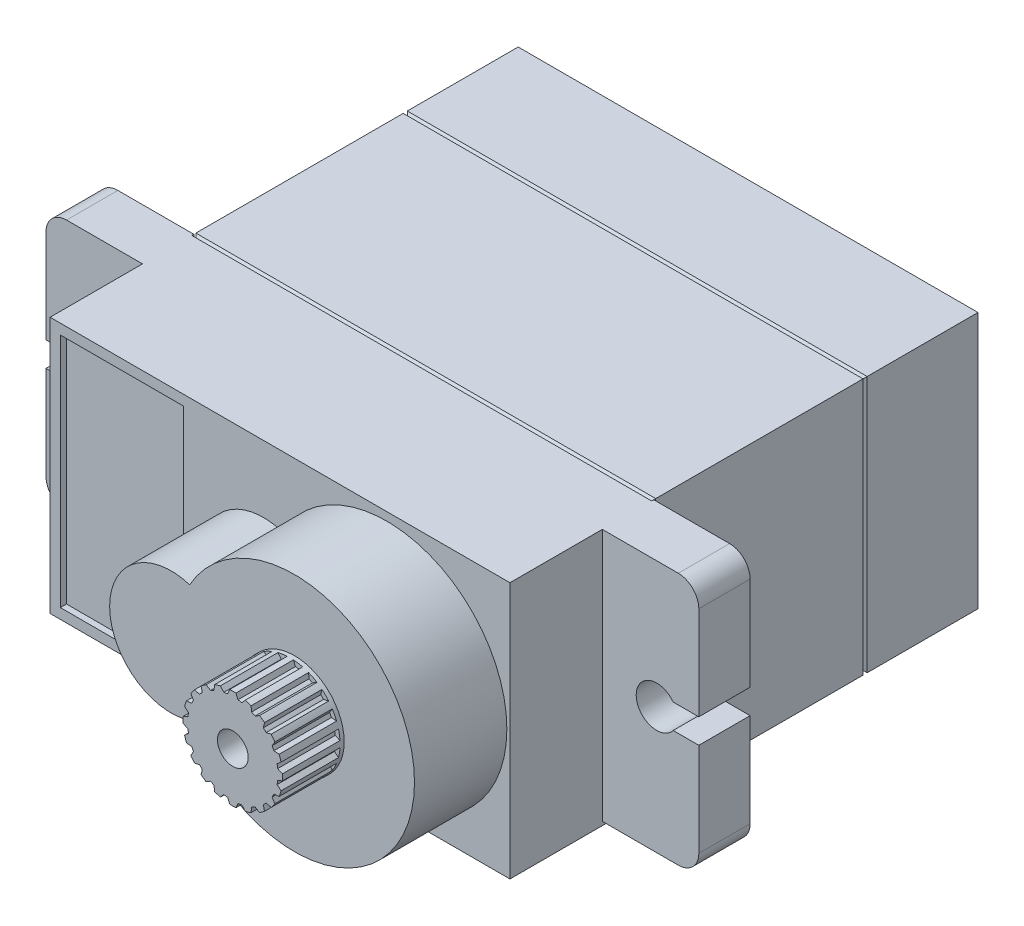
from build123d import *

# Parameters (mm, degrees)
SKETCH_1_W          = 22.4
SKETCH_1_H          = 12.5
EXTRUDE_1_DEPTH     = 5.5
CHAMFER_1_SIZE      = 0.1
SKETCH_2_W          = 22.4
SKETCH_2_H          = 12.5
EXTRUDE_2_DEPTH     = 10.3
CHAMFER_2_SIZE      = 0.1
CHAMFER_3_SIZE      = 0.1
SKETCH_3_W          = 22.4
SKETCH_3_H          = 12.5
EXTRUDE_3_DEPTH     = 7
CHAMFER_4_SIZE      = 0.1
EXTRUDE_4_DEPTH     = 2.5
EXTRUDE_5_DEPTH     = 4.5
SKETCH_6_R          = 2.425
EXTRUDE_6_DEPTH     = 3
SKETCH_7_R          = 0.75
CUT_EXTRUDE_1_DEPTH = 6
CUT_EXTRUDE_START   = -2.8
CUT_EXTRUDE_2_DEPTH = 2.8
FILLET_2_R          = 1
SKETCH_12_W         = 6
SKETCH_12_H         = 11.5
CUT_EXTRUDE_3_DEPTH = 0.3
SKETCH_13_R         = 1
EXTRUDE_10_DEPTH    = 0.1


with BuildPart() as part:
    # 草图1 → 凸台-拉伸1 (new body)
    with BuildSketch(Plane.XY):
        Rectangle(SKETCH_1_W, SKETCH_1_H)
    extrude(amount=EXTRUDE_1_DEPTH)

    # 倒角1
    chamfer_1_edges = [part.edges().sort_by_distance(p)[0] for p in [
        (11.2, 0, 5.5),
        (0, 6.25, 5.5),
        (-11.2, 0, 5.5),
        (0, -6.25, 5.5),
    ]]
    chamfer(chamfer_1_edges, length=CHAMFER_1_SIZE)

    # 草图2 → 凸台-拉伸2 (add)
    with BuildSketch(Plane.XY.offset(5.5)):
        Rectangle(SKETCH_2_W, SKETCH_2_H)
    extrude(amount=EXTRUDE_2_DEPTH)

    # 倒角2
    chamfer_2_edges = [part.edges().sort_by_distance(p)[0] for p in [
        (0, 6.25, 5.5),
        (-11.2, 0, 5.5),
        (0, -6.25, 5.5),
        (11.2, 0, 5.5),
    ]]
    chamfer(chamfer_2_edges, length=CHAMFER_2_SIZE - 0.0001)  # a hair under: the kernel refuses the full size

    # 倒角3
    chamfer_3_edges = [part.edges().sort_by_distance(p)[0] for p in [
        (0, 6.25, 15.8),
        (-11.2, 0, 15.8),
        (0, -6.25, 15.8),
        (11.2, 0, 15.8),
    ]]
    chamfer(chamfer_3_edges, length=CHAMFER_3_SIZE)

    # 草图3 → 凸台-拉伸3 (add)
    with BuildSketch(Plane.XY.offset(15.8)):
        Rectangle(SKETCH_3_W, SKETCH_3_H)
    extrude(amount=EXTRUDE_3_DEPTH)

    # 倒角4
    chamfer_4_edges = [part.edges().sort_by_distance(p)[0] for p in [
        (0, 6.25, 15.8),
        (-11.2, 0, 15.8),
        (0, -6.25, 15.8),
        (11.2, 0, 15.8),
    ]]
    chamfer(chamfer_4_edges, length=CHAMFER_4_SIZE - 0.0001)  # a hair under: the kernel refuses the full size

    # 草图4 → 凸台-拉伸4 (add)
    with BuildSketch(Plane.XY.offset(15.8)):
        with BuildLine():
            Line((-15.9, -0.508346778), (-15.9, -6.066693556))
            Line((-15.9, -6.066693556), (-11.2, -6.066693556))
            Line((-11.2, -6.066693556), (-11.2, 6.25))
            Line((-11.2, 6.25), (-15.9, 6.25))
            Line((-15.9, 6.25), (-15.9, 0.691653222))
            Line((-15.9, 0.691653222), (-14.65, 0.691653222))
            ThreePointArc((-14.65, 0.691653222), (-12.85, 0.091653222), (-14.65, -0.508346778))
            Line((-14.65, -0.508346778), (-15.9, -0.508346778))
        make_face()
        with BuildLine():
            Line((11.2, -6.066693556), (15.9, -6.066693556))
            Line((15.9, -6.066693556), (15.9, -0.508346778))
            Line((15.9, -0.508346778), (14.65, -0.508346778))
            ThreePointArc((14.65, -0.508346778), (12.85, 0.091653222), (14.65, 0.691653222))
            Line((14.65, 0.691653222), (15.9, 0.691653222))
            Line((15.9, 0.691653222), (15.9, 6.25))
            Line((15.9, 6.25), (11.2, 6.25))
            Line((11.2, 6.25), (11.2, -6.066693556))
        make_face()
    extrude(amount=EXTRUDE_4_DEPTH)

    # 草图5 → 凸台-拉伸5 (add)
    with BuildSketch(Plane.XY.offset(22.8)):
        with BuildLine():
            ThreePointArc((0.098125, -2.86240659), (11.05, 0), (0.098125, 2.86240659))
            ThreePointArc((0.098125, 2.86240659), (-3.8, 0), (0.098125, -2.86240659))
        make_face()
    extrude(amount=EXTRUDE_5_DEPTH)

    # 草图6 → 凸台-拉伸6 (add)
    with BuildSketch(Plane.XY.offset(27.3)):
        with Locations((5.2, 0)):
            Circle(SKETCH_6_R)
    extrude(amount=EXTRUDE_6_DEPTH)

    # 草图7 → 切除-拉伸1 (cut)
    with BuildSketch(Plane.XY.offset(30.3)):
        with Locations((5.2, 0)):
            Circle(SKETCH_7_R)
    extrude(amount=-CUT_EXTRUDE_1_DEPTH, mode=Mode.SUBTRACT)

    # 草图8 → 切除-拉伸2 (cut)
    with BuildSketch(Plane.XY.offset(30.3).offset(CUT_EXTRUDE_START)):
        with BuildLine():
            Line((4.95, 2.185749299), (5.05, 2.420356379))
            ThreePointArc((5.05, 2.420356379), (4.820646422, 2.395144226), (4.594727224, 2.348248255))
            Line((4.594727224, 2.348248255), (4.76233045, 2.156025363))
            ThreePointArc((4.76233045, 2.156025363), (4.855844177, 2.172914349), (4.95, 2.185749299))
        make_face()
        with BuildLine():
            Line((5.45, 2.185749299), (5.35, 2.420356379))
            ThreePointArc((5.35, 2.420356379), (5.579353578, 2.395144226), (5.805272776, 2.348248255))
            Line((5.805272776, 2.348248255), (5.63766955, 2.156025363))
            ThreePointArc((5.63766955, 2.156025363), (5.544155823, 2.172914349), (5.45, 2.185749299))
        make_face()
        with BuildLine():
            Line((6.113197808, 2.001516866), (6.090589731, 2.255543157))
            ThreePointArc((6.090589731, 2.255543157), (6.300926962, 2.160690821), (6.501297236, 2.046277231))
            Line((6.501297236, 2.046277231), (6.282496955, 1.915254642))
            ThreePointArc((6.282496955, 1.915254642), (6.198779099, 1.960214353), (6.113197808, 2.001516866))
        make_face()
        with BuildLine():
            Line((6.687005452, 1.621362016), (6.744002334, 1.869941655))
            ThreePointArc((6.744002334, 1.869941655), (6.914733944, 1.714733944), (7.069941655, 1.544002334))
            Line((7.069941655, 1.544002334), (6.821362016, 1.487005452))
            ThreePointArc((6.821362016, 1.487005452), (6.755634919, 1.555634919), (6.687005452, 1.621362016))
        make_face()
        with BuildLine():
            Line((7.115254642, 1.082496955), (7.246277231, 1.301297236))
            ThreePointArc((7.246277231, 1.301297236), (7.360690821, 1.100926962), (7.455543157, 0.890589731))
            Line((7.455543157, 0.890589731), (7.201516866, 0.913197808))
            ThreePointArc((7.201516866, 0.913197808), (7.160214353, 0.998779099), (7.115254642, 1.082496955))
        make_face()
        with BuildLine():
            Line((7.356025363, 0.43766955), (7.548248255, 0.605272776))
            ThreePointArc((7.548248255, 0.605272776), (7.595144226, 0.379353578), (7.620356379, 0.15))
            Line((7.620356379, 0.15), (7.385749299, 0.25))
            ThreePointArc((7.385749299, 0.25), (7.372914349, 0.344155823), (7.356025363, 0.43766955))
        make_face()
        with BuildLine():
            Line((7.385749299, -0.25), (7.620356379, -0.15))
            ThreePointArc((7.620356379, -0.15), (7.595144226, -0.379353578), (7.548248255, -0.605272776))
            Line((7.548248255, -0.605272776), (7.356025363, -0.43766955))
            ThreePointArc((7.356025363, -0.43766955), (7.372914349, -0.344155823), (7.385749299, -0.25))
        make_face()
        with BuildLine():
            Line((7.201516866, -0.913197808), (7.455543157, -0.890589731))
            ThreePointArc((7.455543157, -0.890589731), (7.360690821, -1.100926962), (7.246277231, -1.301297236))
            Line((7.246277231, -1.301297236), (7.115254642, -1.082496955))
            ThreePointArc((7.115254642, -1.082496955), (7.160214353, -0.998779099), (7.201516866, -0.913197808))
        make_face()
        with BuildLine():
            Line((6.821362016, -1.487005452), (7.069941655, -1.544002334))
            ThreePointArc((7.069941655, -1.544002334), (6.914733944, -1.714733944), (6.744002334, -1.869941655))
            Line((6.744002334, -1.869941655), (6.687005452, -1.621362016))
            ThreePointArc((6.687005452, -1.621362016), (6.755634919, -1.555634919), (6.821362016, -1.487005452))
        make_face()
        with BuildLine():
            Line((6.282496955, -1.915254642), (6.501297236, -2.046277231))
            ThreePointArc((6.501297236, -2.046277231), (6.300926962, -2.160690821), (6.090589731, -2.255543157))
            Line((6.090589731, -2.255543157), (6.113197808, -2.001516866))
            ThreePointArc((6.113197808, -2.001516866), (6.198779099, -1.960214353), (6.282496955, -1.915254642))
        make_face()
        with BuildLine():
            Line((5.63766955, -2.156025363), (5.805272776, -2.348248255))
            ThreePointArc((5.805272776, -2.348248255), (5.579353578, -2.395144226), (5.35, -2.420356379))
            Line((5.35, -2.420356379), (5.45, -2.185749299))
            ThreePointArc((5.45, -2.185749299), (5.544155823, -2.172914349), (5.63766955, -2.156025363))
        make_face()
        with BuildLine():
            Line((4.95, -2.185749299), (5.05, -2.420356379))
            ThreePointArc((5.05, -2.420356379), (4.820646422, -2.395144226), (4.594727224, -2.348248255))
            Line((4.594727224, -2.348248255), (4.76233045, -2.156025363))
            ThreePointArc((4.76233045, -2.156025363), (4.855844177, -2.172914349), (4.95, -2.185749299))
        make_face()
        with BuildLine():
            Line((4.286802192, -2.001516866), (4.309410269, -2.255543157))
            ThreePointArc((4.309410269, -2.255543157), (4.099073038, -2.160690821), (3.898702764, -2.046277231))
            Line((3.898702764, -2.046277231), (4.117503045, -1.915254642))
            ThreePointArc((4.117503045, -1.915254642), (4.201220901, -1.960214353), (4.286802192, -2.001516866))
        make_face()
        with BuildLine():
            Line((3.712994548, -1.621362016), (3.655997666, -1.869941655))
            ThreePointArc((3.655997666, -1.869941655), (3.485266056, -1.714733944), (3.330058345, -1.544002334))
            Line((3.330058345, -1.544002334), (3.578637984, -1.487005452))
            ThreePointArc((3.578637984, -1.487005452), (3.644365081, -1.555634919), (3.712994548, -1.621362016))
        make_face()
        with BuildLine():
            Line((3.284745358, -1.082496955), (3.153722769, -1.301297236))
            ThreePointArc((3.153722769, -1.301297236), (3.039309179, -1.100926962), (2.944456843, -0.890589731))
            Line((2.944456843, -0.890589731), (3.198483134, -0.913197808))
            ThreePointArc((3.198483134, -0.913197808), (3.239785647, -0.998779099), (3.284745358, -1.082496955))
        make_face()
        with BuildLine():
            Line((3.043974637, -0.43766955), (2.851751745, -0.605272776))
            ThreePointArc((2.851751745, -0.605272776), (2.804855774, -0.379353578), (2.779643621, -0.15))
            Line((2.779643621, -0.15), (3.014250701, -0.25))
            ThreePointArc((3.014250701, -0.25), (3.027085651, -0.344155823), (3.043974637, -0.43766955))
        make_face()
        with BuildLine():
            Line((3.014250701, 0.25), (2.779643621, 0.15))
            ThreePointArc((2.779643621, 0.15), (2.804855774, 0.379353578), (2.851751745, 0.605272776))
            Line((2.851751745, 0.605272776), (3.043974637, 0.43766955))
            ThreePointArc((3.043974637, 0.43766955), (3.027085651, 0.344155823), (3.014250701, 0.25))
        make_face()
        with BuildLine():
            Line((3.198483134, 0.913197808), (2.944456843, 0.890589731))
            ThreePointArc((2.944456843, 0.890589731), (3.039309179, 1.100926962), (3.153722769, 1.301297236))
            Line((3.153722769, 1.301297236), (3.284745358, 1.082496955))
            ThreePointArc((3.284745358, 1.082496955), (3.239785647, 0.998779099), (3.198483134, 0.913197808))
        make_face()
        with BuildLine():
            Line((3.578637984, 1.487005452), (3.330058345, 1.544002334))
            ThreePointArc((3.330058345, 1.544002334), (3.485266056, 1.714733944), (3.655997666, 1.869941655))
            Line((3.655997666, 1.869941655), (3.712994548, 1.621362016))
            ThreePointArc((3.712994548, 1.621362016), (3.644365081, 1.555634919), (3.578637984, 1.487005452))
        make_face()
        with BuildLine():
            Line((4.117503045, 1.915254642), (3.898702764, 2.046277231))
            ThreePointArc((3.898702764, 2.046277231), (4.099073038, 2.160690821), (4.309410269, 2.255543157))
            Line((4.309410269, 2.255543157), (4.286802192, 2.001516866))
            ThreePointArc((4.286802192, 2.001516866), (4.201220901, 1.960214353), (4.117503045, 1.915254642))
        make_face()
    extrude(amount=CUT_EXTRUDE_2_DEPTH, mode=Mode.SUBTRACT)

    # 圆角2
    fillet_2_edges = [part.edges().sort_by_distance(p)[0] for p in [
        (15.9, -6.066693556, 17.05),
        (15.9, 6.25, 17.05),
        (-15.9, 6.25, 17.05),
        (-15.9, -6.066693556, 17.05),
    ]]
    fillet(fillet_2_edges, radius=FILLET_2_R)

    # 草图12 → 切除-拉伸3 (cut)
    with BuildSketch(Plane.XY.offset(22.8)):
        with Locations((-7.7, 0)):
            Rectangle(SKETCH_12_W, SKETCH_12_H)
    extrude(amount=-CUT_EXTRUDE_3_DEPTH, mode=Mode.SUBTRACT)

    # 草图13 → 凸台-拉伸10 (add)
    # profile 1 of 4: a face of its own
    with BuildSketch(Plane(origin=(0, 0, 0), x_dir=(-1, 0, 0), z_dir=(0, 0, -1))):
        with Locations(Location((-10, 5, 0), (0, 0, 180))):
            Circle(SKETCH_13_R)
        with BuildLine():
            Line((-10.15, 5.785811682), (-10.15, 5.15))
            Line((-10.15, 5.15), (-10.785811682, 5.15))
            ThreePointArc((-10.785811682, 5.15), (-10.8, 5), (-10.785811682, 4.85))
            Line((-10.785811682, 4.85), (-10.15, 4.85))
            Line((-10.15, 4.85), (-10.15, 4.214188318))
            ThreePointArc((-10.15, 4.214188318), (-10, 4.2), (-9.85, 4.214188318))
            Line((-9.85, 4.214188318), (-9.85, 4.85))
            Line((-9.85, 4.85), (-9.214188318, 4.85))
            ThreePointArc((-9.214188318, 4.85), (-9.2, 5), (-9.214188318, 5.15))
            Line((-9.214188318, 5.15), (-9.85, 5.15))
            Line((-9.85, 5.15), (-9.85, 5.785811682))
            ThreePointArc((-9.85, 5.785811682), (-10, 5.8), (-10.15, 5.785811682))
        make_face(mode=Mode.SUBTRACT)
    # profile 2 of 4: a face of its own
    with BuildSketch(Plane(origin=(0, 0, 0), x_dir=(-1, 0, 0), z_dir=(0, 0, -1))):
        with Locations(Location((-10, -5, 0), (0, 0, 180))):
            Circle(SKETCH_13_R)
        with BuildLine():
            Line((-9.85, -5.15), (-9.214188318, -5.15))
            ThreePointArc((-9.214188318, -5.15), (-9.2, -5), (-9.214188318, -4.85))
            Line((-9.214188318, -4.85), (-9.85, -4.85))
            Line((-9.85, -4.85), (-9.85, -4.214188318))
            ThreePointArc((-9.85, -4.214188318), (-10, -4.2), (-10.15, -4.214188318))
            Line((-10.15, -4.214188318), (-10.15, -4.85))
            Line((-10.15, -4.85), (-10.785811682, -4.85))
            ThreePointArc((-10.785811682, -4.85), (-10.8, -5), (-10.785811682, -5.15))
            Line((-10.785811682, -5.15), (-10.15, -5.15))
            Line((-10.15, -5.15), (-10.15, -5.785811682))
            ThreePointArc((-10.15, -5.785811682), (-10, -5.8), (-9.85, -5.785811682))
            Line((-9.85, -5.785811682), (-9.85, -5.15))
        make_face(mode=Mode.SUBTRACT)
    # profile 3 of 4: a face of its own
    with BuildSketch(Plane(origin=(0, 0, 0), x_dir=(-1, 0, 0), z_dir=(0, 0, -1))):
        with Locations(Location((10, -5, 0), (0, 0, 180))):
            Circle(SKETCH_13_R)
        with BuildLine():
            Line((9.85, -4.85), (9.214188318, -4.85))
            ThreePointArc((9.214188318, -4.85), (9.2, -5), (9.214188318, -5.15))
            Line((9.214188318, -5.15), (9.85, -5.15))
            Line((9.85, -5.15), (9.85, -5.785811682))
            ThreePointArc((9.85, -5.785811682), (10, -5.8), (10.15, -5.785811682))
            Line((10.15, -5.785811682), (10.15, -5.15))
            Line((10.15, -5.15), (10.785811682, -5.15))
            ThreePointArc((10.785811682, -5.15), (10.8, -5), (10.785811682, -4.85))
            Line((10.785811682, -4.85), (10.15, -4.85))
            Line((10.15, -4.85), (10.15, -4.214188318))
            ThreePointArc((10.15, -4.214188318), (10, -4.2), (9.85, -4.214188318))
            Line((9.85, -4.214188318), (9.85, -4.85))
        make_face(mode=Mode.SUBTRACT)
    # profile 4 of 4: a face of its own
    with BuildSketch(Plane(origin=(0, 0, 0), x_dir=(-1, 0, 0), z_dir=(0, 0, -1))):
        with Locations(Location((10, 5, 0), (0, 0, 180))):
            Circle(SKETCH_13_R)
        with BuildLine():
            Line((10.15, 5.785811682), (10.15, 5.15))
            Line((10.15, 5.15), (10.785811682, 5.15))
            ThreePointArc((10.785811682, 5.15), (10.8, 5), (10.785811682, 4.85))
            Line((10.785811682, 4.85), (10.15, 4.85))
            Line((10.15, 4.85), (10.15, 4.214188318))
            ThreePointArc((10.15, 4.214188318), (10, 4.2), (9.85, 4.214188318))
            Line((9.85, 4.214188318), (9.85, 4.85))
            Line((9.85, 4.85), (9.214188318, 4.85))
            ThreePointArc((9.214188318, 4.85), (9.2, 5), (9.214188318, 5.15))
            Line((9.214188318, 5.15), (9.85, 5.15))
            Line((9.85, 5.15), (9.85, 5.785811682))
            ThreePointArc((9.85, 5.785811682), (10, 5.8), (10.15, 5.785811682))
        make_face(mode=Mode.SUBTRACT)
    extrude(amount=EXTRUDE_10_DEPTH)


solid = part.part
